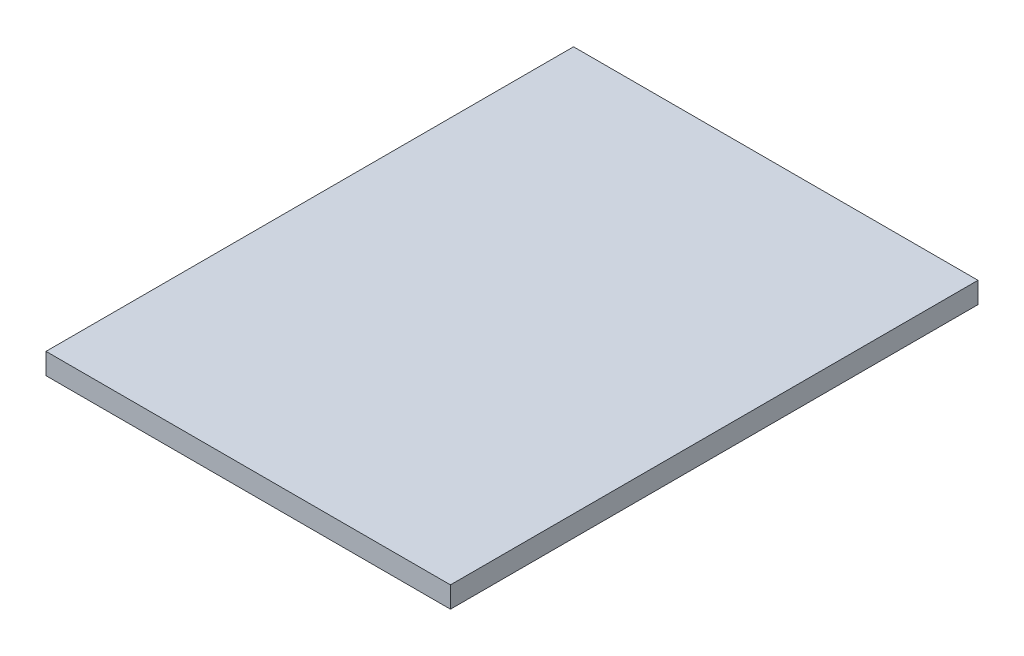
from build123d import *

# Parameters (mm, degrees)
SKETCH_1_W             = 115
SKETCH_1_H             = 150
SM_BASE_FLANGE_1_DEPTH = 6


# Sheet-metal steps are written as plain solids
with BuildPart() as part:
    # Sketch 1 → Базовая кромка1 (new body)
    with BuildSketch(Plane(origin=(0, 0, 0), x_dir=(1, 0, 0), z_dir=(0, 1, 0))):
        Rectangle(SKETCH_1_W, SKETCH_1_H)
    extrude(amount=-SM_BASE_FLANGE_1_DEPTH)


solid = part.part
